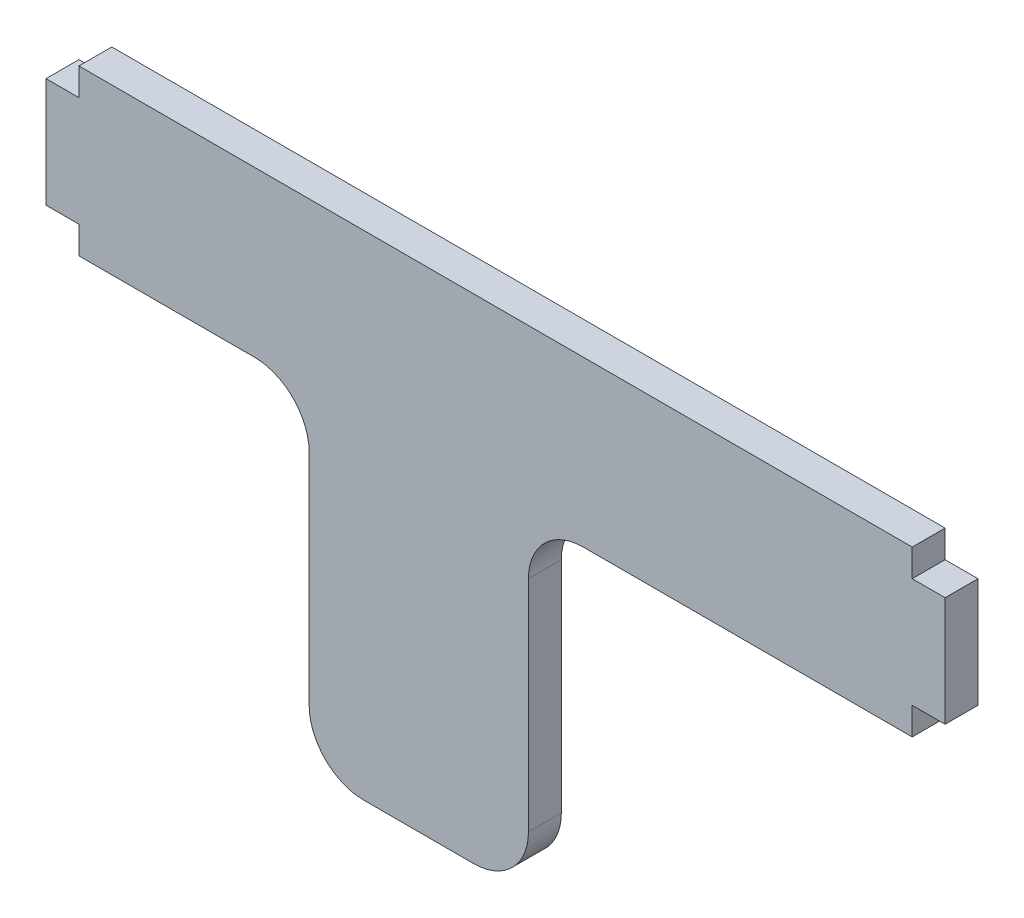
from build123d import *

# Parameters (mm, degrees)
RESSALTO_EXTRUS_O1_DEPTH = 3
FILETE1_R                = 5


with BuildPart() as part:
    # Esboço1 → Ressalto-extrusão1 (new body)
    with BuildSketch(Plane.XY):
        Polygon((3, -7.5), (38, -7.5), (38, -5), (41, -5), (41, 5), (38, 5), (38, 7.5), (-38, 7.5), (-38, 5), (-41, 5), (-41, -5), (-38, -5), (-38, -7.5), (-17, -7.5), (-17, -37.5), (3, -37.5), align=None)
    extrude(amount=RESSALTO_EXTRUS_O1_DEPTH)

    # Filete1
    filete1_edges = [part.edges().sort_by_distance(p)[0] for p in [
        (3, -37.5, 1.5),
        (-17, -37.5, 1.5),
        (-17, -7.5, 1.5),
        (3, -7.5, 1.5),
    ]]
    fillet(filete1_edges, radius=FILETE1_R)


solid = part.part
